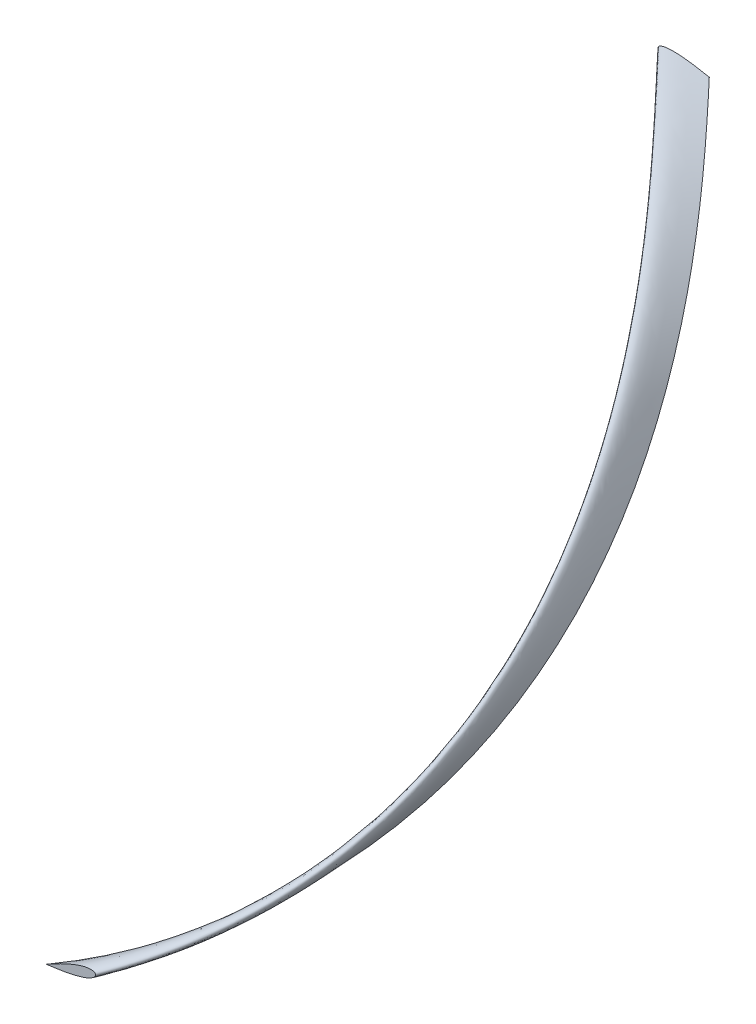
from build123d import *

# Parameters (mm, degrees)
SWEEP1_PITCH       = 1000
SWEEP1_HEIGHT      = 450
SWEEP1_RADIUS      = 150
SWEEP1_START_ANGLE = 90


with BuildPart() as part:
    # Sweep1: sweep along a helix
    with BuildLine() as sweep1_path:
        add(Helix(SWEEP1_PITCH, SWEEP1_HEIGHT, SWEEP1_RADIUS, center=(10.15, -150, 0), direction=(0, 0, 1), lefthand=True, mode=Mode.PRIVATE).rotate(Axis((10.15, -150, 0), (0, 0, 1)), SWEEP1_START_ANGLE))
    # Sketch1 → Sweep1 (sweep)
    with BuildSketch(Plane.XY):
        with BuildLine():
            Line((35, 0.06615), (35, -0.06615))
            add(Edge.make_bspline(
                [(35, 0.06615), (34.416950603, 0.186684081), (33.252162972, 0.427481185), (30.920448033, 0.874241145), (28.00570077, 1.387985954), (24.505248743, 1.934859092), (21.005337418, 2.409501099), (17.505378211, 2.797696033), (14.004576313, 3.07282682), (11.083809685, 3.170555026), (8.748588185, 3.131550759), (6.995754173, 3.027755742), (5.239624765, 2.827360271), (3.778007439, 2.547326939), (2.61223578, 2.214270232), (1.721987986, 1.877782756), (0.976309995, 1.47258359), (0.290395921, 0.91214368), (-0.189499557, 0), (0.290395921, -0.91214368), (0.976309995, -1.47258359), (1.721987986, -1.877782756), (2.61223578, -2.214270232), (3.778007439, -2.547326939), (5.239624765, -2.827360271), (6.995754173, -3.027755741), (8.748588185, -3.131550759), (11.083809685, -3.170555026), (14.004576313, -3.072826819), (17.505378211, -2.797696033), (21.005337418, -2.409501099), (24.505248743, -1.934859092), (28.00570077, -1.387985954), (30.920448033, -0.874241145), (33.252162972, -0.427481185), (34.416950603, -0.186684081), (35, -0.06615)],
                knots=[0, 0, 0, 0, 0.024603844, 0.049152359, 0.098108667, 0.146905312, 0.195554797, 0.244056277, 0.292409554, 0.340643731, 0.364754111, 0.3889056, 0.413178108, 0.437756239, 0.450304697, 0.463229879, 0.477067953, 0.485035559, 0.5, 0.514964441, 0.522932047, 0.536770121, 0.549695303, 0.562243761, 0.586821892, 0.6110944, 0.635245889, 0.659356269, 0.707590446, 0.755943723, 0.804445203, 0.853094688, 0.901891333, 0.950847641, 0.975396156, 1, 1, 1, 1], degree=3))
        make_face()
    sweep(path=sweep1_path.line, is_frenet=True)


solid = part.part
